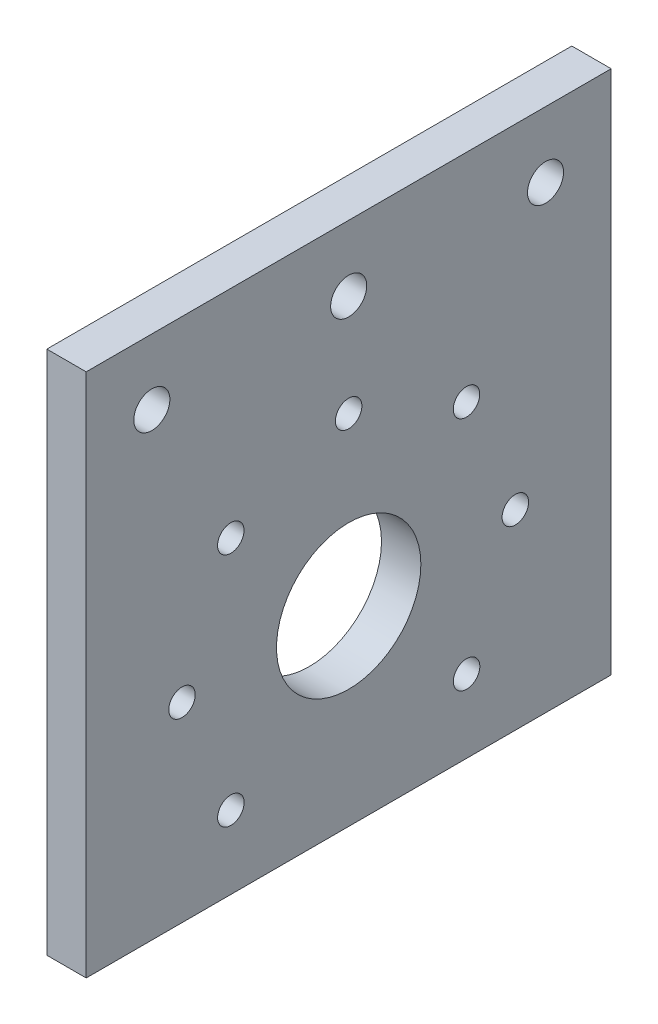
from build123d import *

# Parameters (mm, degrees)
SKETCH1_W           = 80
SKETCH1_H           = 80
BOSS_EXTRUDE1_DEPTH = 6
SKETCH2_R           = 11
SKETCH2_R_2         = 2.75
CUT_EXTRUDE1_DEPTH  = 76.76497212
SKETCH3_R           = 2.0193
CUT_EXTRUDE2_DEPTH  = 76.76497212


with BuildPart() as part:
    # Sketch1 → Boss-Extrude1 (new body)
    with BuildSketch(Plane(origin=(0, 0, 0), x_dir=(0, 0, -1), z_dir=(1, 0, 0))):
        with Locations((11.749387771, -15.012106538)):
            Rectangle(SKETCH1_W, SKETCH1_H)
    extrude(amount=BOSS_EXTRUDE1_DEPTH)

    # Sketch2 → Cut-Extrude1 (cut, through all)
    with BuildSketch(Plane(origin=(6, 0, 0), x_dir=(0, 0, -1), z_dir=(1, 0, 0))):
        with Locations((11.749387771, -25.911850923)):
            Circle(SKETCH2_R)
        with Locations((-18.250612229, 14.987893462)):
            Circle(SKETCH2_R_2)
        with Locations((41.749387771, 14.987893462)):
            Circle(SKETCH2_R_2)
        with Locations((11.749387771, 14.987893462)):
            Circle(SKETCH2_R_2)
    extrude(amount=-CUT_EXTRUDE1_DEPTH, mode=Mode.SUBTRACT)

    # Sketch3 → Cut-Extrude2 (cut, through all)
    with BuildSketch(Plane.ZY):
        with Locations((-37.149386593, -25.904114427)):
            Circle(SKETCH3_R)
        with Locations((13.650611051, -25.91958742)):
            Circle(SKETCH3_R)
        with Locations((6.216594167, -7.956810044)):
            Circle(SKETCH3_R)
        with Locations((-29.704428651, -7.945868985)):
            Circle(SKETCH3_R)
        with Locations((-11.741651274, -0.511852102)):
            Circle(SKETCH3_R)
        with Locations((6.205653109, -43.877832862)):
            Circle(SKETCH3_R)
        with Locations((-29.715369709, -43.866891803)):
            Circle(SKETCH3_R)
    extrude(amount=-CUT_EXTRUDE2_DEPTH, mode=Mode.SUBTRACT)


solid = part.part
